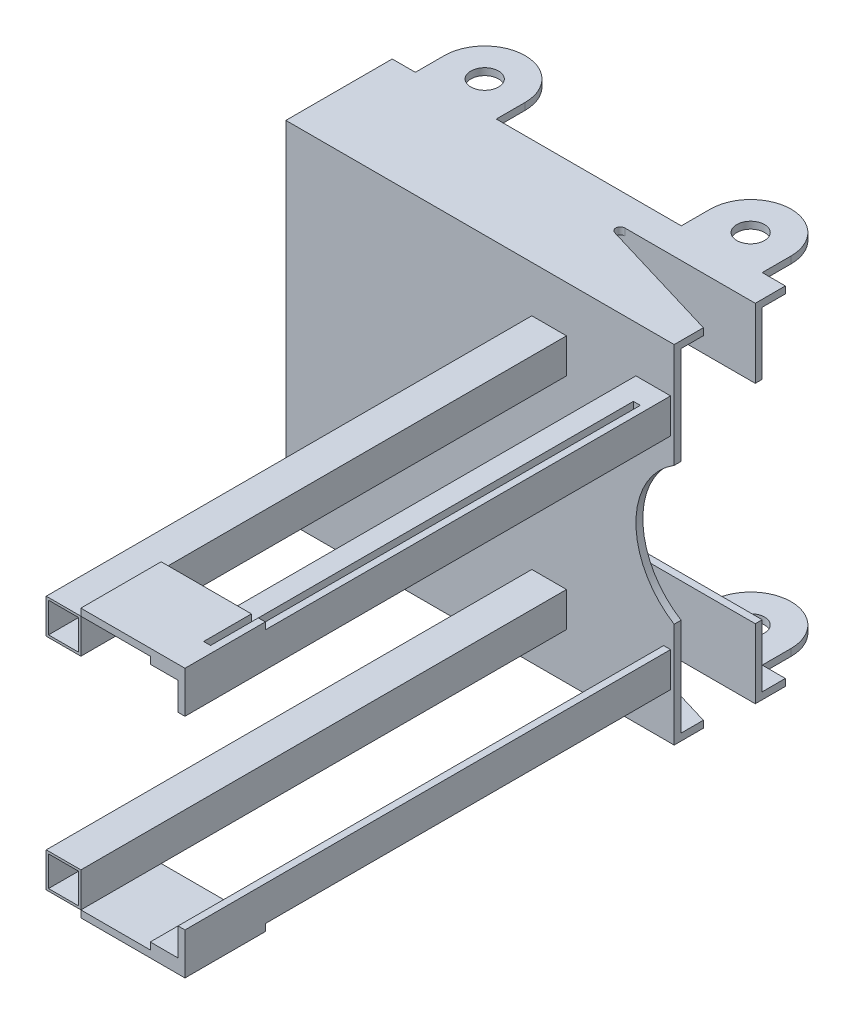
from build123d import *

# Parameters (mm, degrees)
SKETCH1_W               = 170
SKETCH1_H               = 150
BOSS_EXTRUDE1_DEPTH     = 3
SKETCH2_W               = 170
SKETCH2_H               = 3
BOSS_EXTRUDE3_DEPTH     = 10
SKETCH3_W               = 35
SKETCH3_H               = 3
BOSS_EXTRUDE4_DEPTH     = 30
FILLET1_R               = 17.5
FILLET1_OF_MIRROR2_R    = 17.5
MIRROR3_START           = -75
MIRROR3_DEPTH           = 3
SKETCH7_W               = 70
SKETCH7_H               = 90
CUT_EXTRUDE1_DEPTH      = 3
SKETCH12_R              = 6
CUT_EXTRUDE2_DEPTH      = 175.453432182
BOSS_EXTRUDE5_DEPTH     = 3
FILLET2_R               = 2
FILLET3_R               = 2
FILLET2_OF_MIRROR5_R    = 2
FILLET3_OF_MIRROR5_R    = 2
SKETCH13_W              = 186.373128994
SKETCH13_H              = 150
BOSS_EXTRUDE6_DEPTH     = 3
SKETCH14_W              = 15
SKETCH14_H              = 15
SKETCH14_W_2            = 13
SKETCH14_H_2            = 13
BOSS_EXTRUDE8_DEPTH     = 210
SKETCH16_W              = 45.036207967
SKETCH16_H              = 34.729984481
BOSS_EXTRUDE9_DEPTH     = 3
CUT_EXTRUDE3_DEPTH      = 10
CUT_EXTRUDE3_DEPTH_BACK = 150
SKETCH17_W              = 3
SKETCH17_H              = 185.851643629
SKETCH18_R              = 35
CUT_EXTRUDE4_DEPTH      = 44
CUT_EXTRUDE6_DEPTH      = 2
CUT_EXTRUDE6_DEPTH_BACK = 17
SKETCH19_W              = 29.178069821
SKETCH19_H              = 150


# Read off the part's stored shape, not the designer's step: Mirror3
with BuildPart() as part:
    # Sketch1 → Boss-Extrude1 (new body)
    with BuildSketch(Plane.XY):
        Rectangle(SKETCH1_W, SKETCH1_H)
    extrude(amount=BOSS_EXTRUDE1_DEPTH)

    # Sketch2 → Boss-Extrude3 (add)
    with BuildSketch(Plane(origin=(0, 0, 0), x_dir=(-1, 0, 0), z_dir=(0, 0, -1))):
        with Locations((0, 73.5)):
            Rectangle(SKETCH2_W, SKETCH2_H)
        with Locations((0, -73.5)):
            Rectangle(SKETCH2_W, SKETCH2_H)
    extrude(amount=BOSS_EXTRUDE3_DEPTH)

    # Sketch3 → Boss-Extrude4 (add)
    with BuildSketch(Plane(origin=(0, 0, -10), x_dir=(-1, 0, 0), z_dir=(0, 0, -1))):
        with Locations((57.5, 73.5)):
            Rectangle(SKETCH3_W, SKETCH3_H)
    boss_extrude4 = extrude(amount=BOSS_EXTRUDE4_DEPTH)

    # Fillet1
    fillet1_edges = [part.edges().sort_by_distance(p)[0] for p in [
        (-40, 73.5, -40),
        (-75, 73.5, -40),
    ]]
    fillet(fillet1_edges, radius=FILLET1_R - 0.0001)  # a hair under: the kernel refuses the full size

    # Mirror2: Boss-Extrude4 across plane
    add(boss_extrude4.mirror(Plane(origin=(0, 0, 0), x_dir=(0, 0, 1), z_dir=(1, 0, 0))))

    # Fillet1 of Mirror2
    fillet1_of_mirror2_edges = [part.edges().sort_by_distance(p)[0] for p in [
        (40, 73.5, -40),
        (75, 73.5, -40),
    ]]
    fillet(fillet1_of_mirror2_edges, radius=FILLET1_OF_MIRROR2_R - 0.0001)  # a hair under: the kernel refuses the full size

    # Mirror3 outline → Mirror3 (add)
    with BuildSketch(Plane(origin=(0, 0, 0), x_dir=(1, 0, 0), z_dir=(0, 1, 0)).offset(MIRROR3_START)):
        with BuildLine():
            ThreePointArc((-57.5, 40), (-69.874368671, 34.874368671), (-75, 22.5))
            Line((-75, 22.5), (-75, 10))
            Line((-75, 10), (-40, 10))
            Line((-40, 10), (-40, 22.5))
            ThreePointArc((-40, 22.5), (-45.125631329, 34.874368671), (-57.5, 40))
        make_face()
        with BuildLine():
            Line((40, 22.5), (40, 10))
            Line((40, 10), (75, 10))
            Line((75, 10), (75, 22.5))
            ThreePointArc((75, 22.5), (69.874368671, 34.874368671), (57.5, 40))
            ThreePointArc((57.5, 40), (45.125631329, 34.874368671), (40, 22.5))
        make_face()
    extrude(amount=MIRROR3_DEPTH)

    # Sketch7 → Cut-Extrude1 (cut)
    with BuildSketch(Plane.XY.offset(3)):
        with Locations((-50, 0)):
            Rectangle(SKETCH7_W, SKETCH7_H)
        with Locations((50, 0)):
            Rectangle(SKETCH7_W, SKETCH7_H)
    extrude(amount=-CUT_EXTRUDE1_DEPTH, mode=Mode.SUBTRACT)

    # Sketch12 → Cut-Extrude2 (cut, symmetric)
    with BuildSketch(Plane.XZ.offset(-72)):
        with Locations((-57.5, -22.5)):
            Circle(SKETCH12_R)
    cut_extrude2 = extrude(amount=CUT_EXTRUDE2_DEPTH, both=True, mode=Mode.SUBTRACT)

    # Mirror4: Cut-Extrude2 across plane
    add(cut_extrude2.mirror(Plane(origin=(0, 0, 0), x_dir=(0, 0, 1), z_dir=(1, 0, 0))), mode=Mode.SUBTRACT)

    # Sketch10 → Boss-Extrude5 (add)
    with BuildSketch(Plane(origin=(0, 75, 0), x_dir=(1, 0, 0), z_dir=(0, 1, 0))):
        Polygon((15, -3), (-85, -3), (-85, -33), (115, -33), align=None)
    boss_extrude5 = extrude(amount=-BOSS_EXTRUDE5_DEPTH)

    # Fillet2
    fillet2_edges = [part.edges().sort_by_distance(p)[0] for p in [
        (115, 73.5, 33),
    ]]
    fillet(fillet2_edges, radius=FILLET2_R)

    # Fillet3
    fillet3_edges = [part.edges().sort_by_distance(p)[0] for p in [
        (15, 73.5, 3),
    ]]
    fillet(fillet3_edges, radius=FILLET3_R)

    # Mirror5: Boss-Extrude5 across plane
    add(boss_extrude5.mirror(Plane.ZX))

    # Fillet2 of Mirror5
    fillet2_of_mirror5_edges = [part.edges().sort_by_distance(p)[0] for p in [
        (115, -73.5, 33),
    ]]
    fillet(fillet2_of_mirror5_edges, radius=FILLET2_OF_MIRROR5_R)

    # Fillet3 of Mirror5
    fillet3_of_mirror5_edges = [part.edges().sort_by_distance(p)[0] for p in [
        (15, -73.5, 3),
    ]]
    fillet(fillet3_of_mirror5_edges, radius=FILLET3_OF_MIRROR5_R)

    # Sketch13 → Boss-Extrude6 (add)
    with BuildSketch(Plane.XY.offset(33)):
        with Locations((8.186564497, 0)):
            Rectangle(SKETCH13_W, SKETCH13_H)
    extrude(amount=BOSS_EXTRUDE6_DEPTH)

    # Sketch14 → Boss-Extrude8 (add)
    # profile 1 of 2: a face of its own
    with BuildSketch(Plane.XY.offset(36)):
        with Locations((28.873128994, -47.5)):
            Rectangle(SKETCH14_W, SKETCH14_H)
        with Locations((28.873128994, -47.5)):
            Rectangle(SKETCH14_W_2, SKETCH14_H_2, mode=Mode.SUBTRACT)
    # profile 2 of 2: a face of its own
    with BuildSketch(Plane.XY.offset(36)):
        Polygon((66.373128994, -55), (81.373128994, -55), (81.373128994, -40), (78.373128994, -40), (78.373128994, -52), (66.373128994, -52), align=None)
    boss_extrude8 = extrude(amount=BOSS_EXTRUDE8_DEPTH)

    # Mirror7: Boss-Extrude8 across plane
    add(boss_extrude8.mirror(Plane.ZX))

    # Sketch16 → Boss-Extrude9 (add)
    with BuildSketch(Plane.XZ.offset(55)):
        with Locations((58.855025011, 228.63500776)):
            Rectangle(SKETCH16_W, SKETCH16_H)
    boss_extrude9 = extrude(amount=BOSS_EXTRUDE9_DEPTH)

    # Mirror8: Boss-Extrude9 across plane
    add(boss_extrude9.mirror(Plane.ZX))

    # Sketch17 → Cut-Extrude3 (cut, two sides: drawn at the far end of the back side and taken through both)
    with BuildSketch(Plane(origin=(0, 55, 0), x_dir=(1, 0, 0), z_dir=(0, 1, 0)).offset(-CUT_EXTRUDE3_DEPTH_BACK)):
        with Locations((76.873128994, -138.999103357)):
            Rectangle(SKETCH17_W, SKETCH17_H)
    extrude(amount=CUT_EXTRUDE3_DEPTH + CUT_EXTRUDE3_DEPTH_BACK, mode=Mode.SUBTRACT)

    # Sketch18 → Cut-Extrude4 (cut)
    with BuildSketch(Plane.XY.offset(36)):
        with Locations((101.373128994, 0)):
            Circle(SKETCH18_R)
    extrude(amount=-CUT_EXTRUDE4_DEPTH, mode=Mode.SUBTRACT)

    # Sketch19 → Cut-Extrude6 (cut, two sides: drawn at the far end of the back side and taken through both)
    with BuildSketch(Plane.XY.offset(36).offset(-CUT_EXTRUDE6_DEPTH_BACK)):
        with Locations((97.511085228, 0)):
            Rectangle(SKETCH19_W, SKETCH19_H)
    extrude(amount=CUT_EXTRUDE6_DEPTH + CUT_EXTRUDE6_DEPTH_BACK, mode=Mode.SUBTRACT)


solid = part.part
